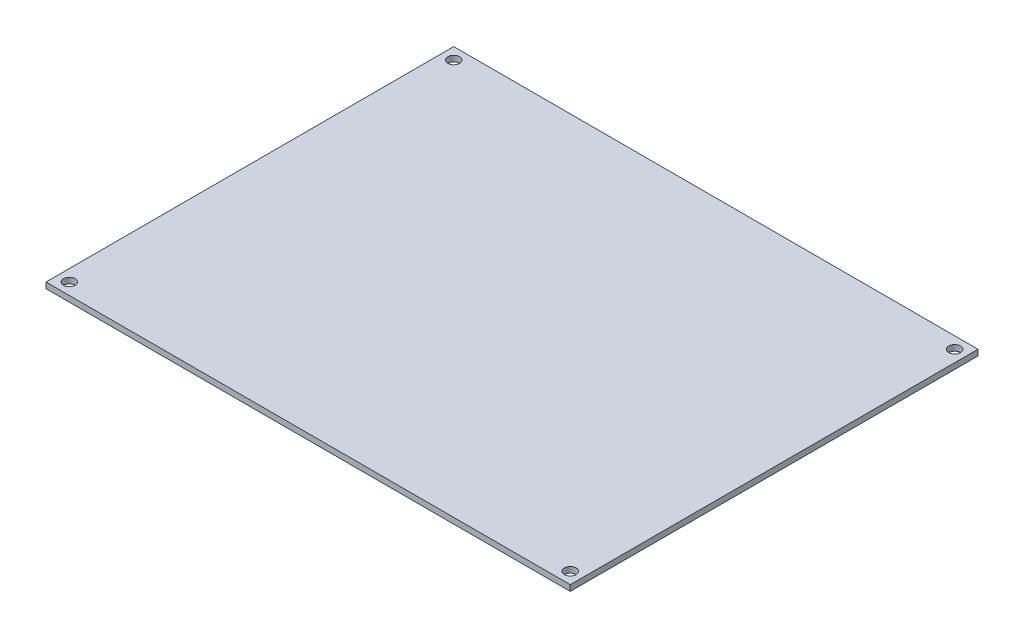
from build123d import *

# Parameters (mm, degrees)
SKETCH1_W           = 90
SKETCH1_H           = 70
BOSS_EXTRUDE1_DEPTH = 1
SKETCH2_R           = 1
CUT_EXTRUDE1_DEPTH  = 10


with BuildPart() as part:
    # Sketch1 → Boss-Extrude1 (new body)
    with BuildSketch(Plane(origin=(0, 0, 0), x_dir=(1, 0, 0), z_dir=(0, 1, 0))):
        with Locations((45, 35)):
            Rectangle(SKETCH1_W, SKETCH1_H)
    extrude(amount=BOSS_EXTRUDE1_DEPTH)

    # Sketch2 → Cut-Extrude1 (cut)
    with BuildSketch(Plane(origin=(0, 1, 0), x_dir=(1, 0, 0), z_dir=(0, 1, 0))):
        with Locations((88, 68)):
            Circle(SKETCH2_R)
        with Locations((88, 2)):
            Circle(SKETCH2_R)
        with Locations((2, 2)):
            Circle(SKETCH2_R)
        with Locations((2, 68)):
            Circle(SKETCH2_R)
    extrude(amount=-CUT_EXTRUDE1_DEPTH, mode=Mode.SUBTRACT)


solid = part.part
